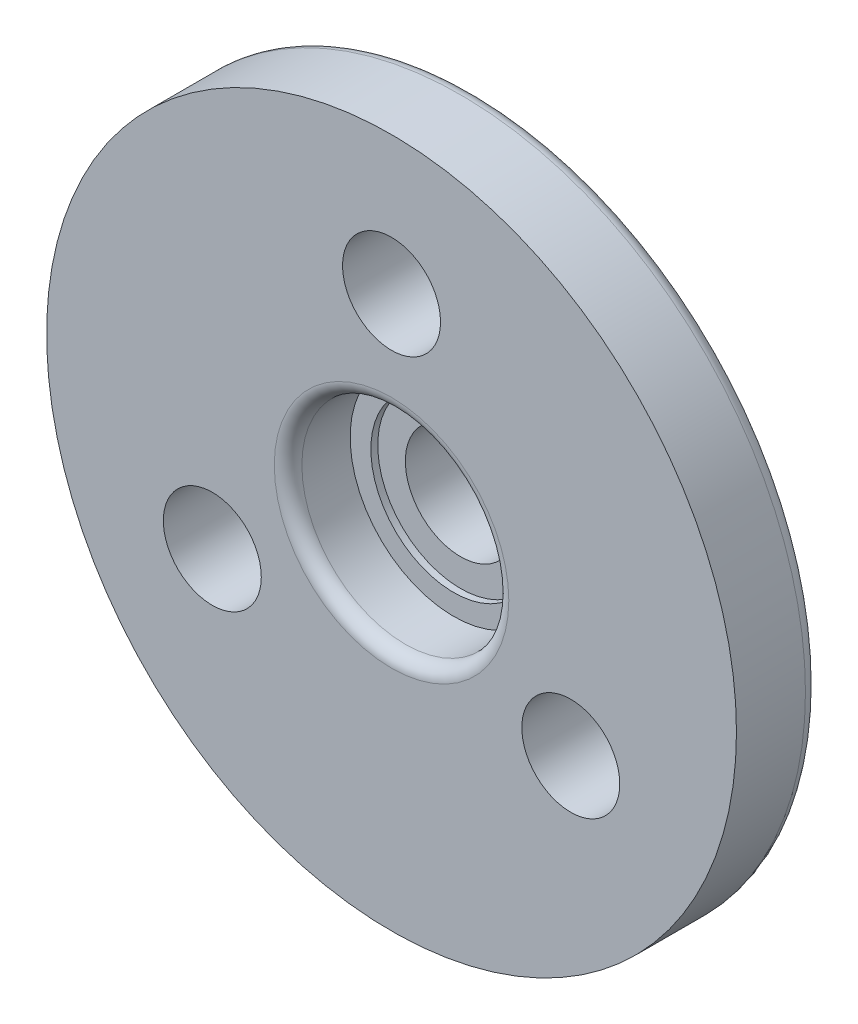
from build123d import *

# Parameters (mm, degrees)
KREISMUSTER1_COUNT = 3
VERRUNDUNG1_R      = 1


with BuildPart() as part:
    # Skizze2 → Rotation1 (revolve)
    with BuildSketch(Plane(origin=(0, 0, 0), x_dir=(0, 0, -1), z_dir=(1, 0, 0)), mode=Mode.PRIVATE) as rotation1_sk:
        Polygon((9.5, 7), (8.5, 7), (8.5, 25), (2.5, 25), (2.5, 7.5), (7, 7.5), (7, 6), (7.5, 6), (7.5, 4), (18.5, 4), (18.5, 5), (9.5, 5), align=None)
    revolve(rotation1_sk.sketch.rotate(Axis((0, 0, 0), (0, 0, -1)), 90), axis=Axis((0, 0, 0), (0, 0, -1)))

    # Skizze4 → Ø7.1 (7.1) Durchmesser Bohrung1 (revolve, cut)
    with BuildSketch(Plane(origin=(0, 15, -2.5), x_dir=(0, -1, 0), z_dir=(1, 0, 0))):
        Polygon((0, 0), (0, 11.633055198), (3.55, 9.5), (3.55, 0), align=None)
    f_7_1_7_1_durchmesser_bohrung1 = revolve(axis=Axis((0, 15, 3.85), (0, 0, -1)), mode=Mode.SUBTRACT)

    # Kreismuster1: Ø7.1 (7.1) Durchmesser Bohrung1 ×3 about axis
    kreismuster1_axis = Axis((0, 0, 0), (0, 0, 1))
    for i in range(1, KREISMUSTER1_COUNT):
        add(f_7_1_7_1_durchmesser_bohrung1.rotate(kreismuster1_axis, i * 360 / KREISMUSTER1_COUNT), mode=Mode.SUBTRACT)

    # Verrundung1
    verrundung1_edges = [part.edges().sort_by_distance(p)[0] for p in [
        (-25, 0, -8.5),
        (-7.5, 0, -2.5),
        (-5, 0, -18.5),
    ]]
    fillet(verrundung1_edges, radius=VERRUNDUNG1_R - 0.0001)  # a hair under: the kernel refuses the full size


solid = part.part
